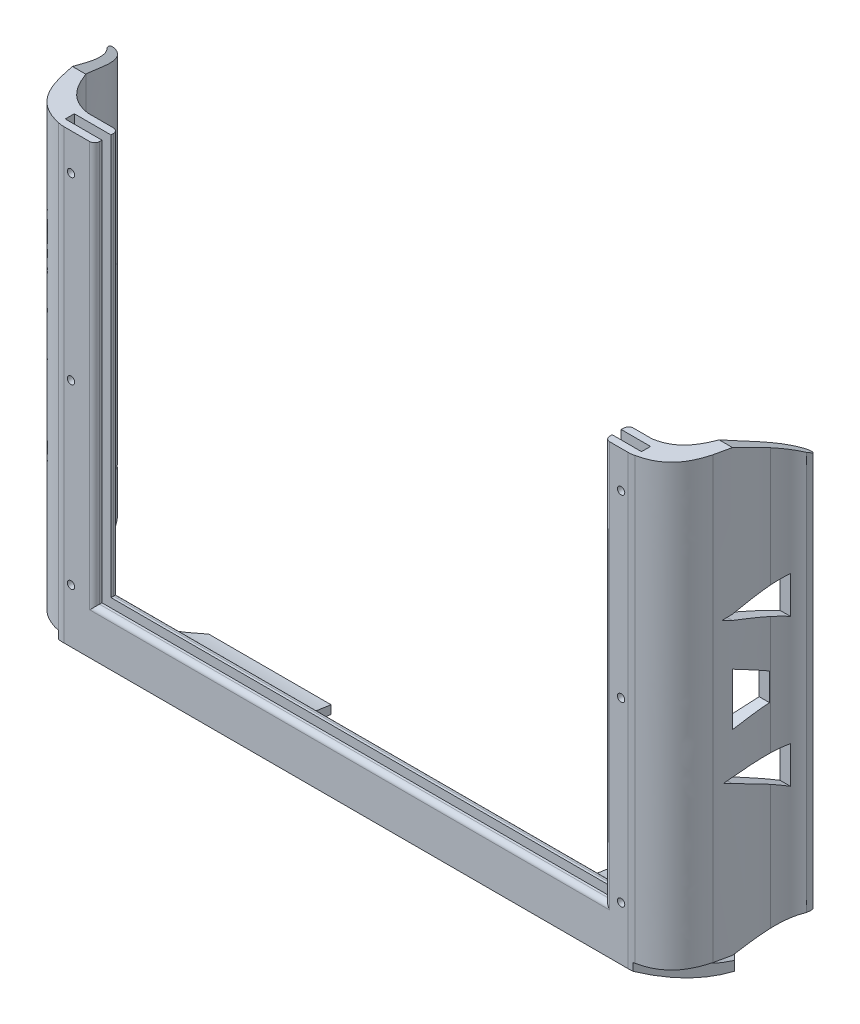
from build123d import *

# Parameters (mm, degrees)
SKETCH_1_W           = 235
SKETCH_1_H           = 175.89
EXTRUDE_1_DEPTH      = 3
SKETCH_2_W           = 235
SKETCH_2_H           = 3
EXTRUDE_2_DEPTH      = 4
SKETCH_3_W           = 235
SKETCH_3_H           = 3
EXTRUDE_3_DEPTH      = 7
SKETCH_5_W           = 235
SKETCH_5_H           = 3
CUT_EXTRUDE_2_DEPTH  = 0.3
EXTRUDE_4_DEPTH      = 0.35
EXTRUDE_5_DEPTH      = 0.35
SKETCH_8_W           = 9.7
SKETCH_8_H           = 179.89
EXTRUDE_6_DEPTH      = 3
SKETCH_9_W           = 9.7
SKETCH_9_H           = 179.89
EXTRUDE_7_DEPTH      = 3
SKETCH_10_W          = 3
SKETCH_10_H          = 176.89
EXTRUDE_8_DEPTH      = 235.7
SKETCH_11_W          = 208.7
SKETCH_11_H          = 163.89
CUT_EXTRUDE_4_DEPTH  = 153.160098334
EXTRUDE_9_DEPTH      = 179.89
FILLET_3_R           = 2
FILLET_4_R           = 2
FILLET_5_R           = 10
SKETCH_13_R          = 1.5
CUT_EXTRUDE_5_DEPTH  = 184.480476092
FILLET_6_R           = 10
FILLET_7_R           = 20
FILLET_8_R           = 0.7
EXTRUDE_10_DEPTH     = 179.89
FILLET_9_R           = 20
EXTRUDE_12_DEPTH     = 235
CUT_EXTRUDE_9_DEPTH  = 235
CUT_EXTRUDE_START    = -235
CUT_EXTRUDE_10_DEPTH = 235
SKETCH_22_W          = 115
SKETCH_22_H          = 25
CUT_EXTRUDE_11_DEPTH = 235
EXTRUDE_13_REACH     = 259.409
CUT_EXTRUDE_12_DEPTH = 235
EXTRUDE_14_REACH     = 259.409
CUT_EXTRUDE_13_DEPTH = 235
CUT_EXTRUDE_14_DEPTH = 235
CUT_EXTRUDE_START_2  = -31.099365542
CUT_EXTRUDE_18_DEPTH = 297.898731085
CUT_EXTRUDE_19_DEPTH = 237.996358915
CHAMFER_1_SIZE       = 10


# Read off the part's stored shape, not the designer's step: 切除-拉伸18
with BuildPart() as part:
    # 草图1 → 凸台-拉伸1 (new body)
    with BuildSketch(Plane.XY):
        Rectangle(SKETCH_1_W, SKETCH_1_H)
    extrude(amount=EXTRUDE_1_DEPTH)

    # 草图2 → 凸台-拉伸2 (add)
    with BuildSketch(Plane.XZ.offset(87.945)):
        with Locations((0, 1.5)):
            Rectangle(SKETCH_2_W, SKETCH_2_H)
    extrude(amount=EXTRUDE_2_DEPTH)

    # 草图3 → 凸台-拉伸3 (add)
    with BuildSketch(Plane.XY.offset(3)):
        with Locations((0, -90.445)):
            Rectangle(SKETCH_3_W, SKETCH_3_H)
    extrude(amount=EXTRUDE_3_DEPTH)

    # 草图5 → 切除-拉伸2 (cut)
    with BuildSketch(Plane.XY.offset(10)):
        with Locations((0, -90.445)):
            Rectangle(SKETCH_5_W, SKETCH_5_H)
    extrude(amount=-CUT_EXTRUDE_2_DEPTH, mode=Mode.SUBTRACT)

    # 草图6 → 凸台-拉伸4 (add)
    with BuildSketch(Plane(origin=(117.5, 0, 0), x_dir=(0, 0, -1), z_dir=(1, 0, 0))):
        Polygon((-9.7, -88.945), (-9.7, -91.945), (0, -91.945), (0, 87.945), (-3, 87.945), (-3, -88.945), align=None)
    extrude(amount=EXTRUDE_4_DEPTH)

    # 草图7 → 凸台-拉伸5 (add)
    with BuildSketch(Plane.ZY.offset(117.5)):
        Polygon((9.7, -91.945), (9.7, -88.945), (3, -88.945), (3, 87.945), (0, 87.945), (0, -91.945), align=None)
    extrude(amount=EXTRUDE_5_DEPTH)

    # 草图8 → 凸台-拉伸6 (add)
    with BuildSketch(Plane.ZY.offset(117.85)):
        with Locations((4.85, -2)):
            Rectangle(SKETCH_8_W, SKETCH_8_H)
    extrude(amount=EXTRUDE_6_DEPTH)

    # 草图9 → 凸台-拉伸7 (add)
    with BuildSketch(Plane(origin=(117.85, 0, 0), x_dir=(0, 0, -1), z_dir=(1, 0, 0))):
        with Locations((-4.85, -2)):
            Rectangle(SKETCH_9_W, SKETCH_9_H)
    extrude(amount=EXTRUDE_7_DEPTH)

    # 草图10 → 凸台-拉伸8 (add)
    with BuildSketch(Plane(origin=(-117.85, 0, 0), x_dir=(0, 0, -1), z_dir=(1, 0, 0))):
        with Locations((-8.2, -0.5)):
            Rectangle(SKETCH_10_W, SKETCH_10_H)
    extrude(amount=EXTRUDE_8_DEPTH)

    # 草图11 → 切除-拉伸4 (cut, through all)
    with BuildSketch(Plane(origin=(0, 0, 0), x_dir=(-1, 0, 0), z_dir=(0, 0, -1))):
        with Locations((-1.5, 6)):
            Rectangle(SKETCH_11_W, SKETCH_11_H)
    extrude(amount=-CUT_EXTRUDE_4_DEPTH, mode=Mode.SUBTRACT)

    # 草图12 → 凸台-拉伸9 (add)
    with BuildSketch(Plane(origin=(0, 87.945, 0), x_dir=(1, 0, 0), z_dir=(0, 1, 0))):
        Polygon((120.85, -9.7), (149.423934101, 34.3), (149.423934101, 44), (120.85, 0), align=None)
        Polygon((-120.85, 0), (-149.423934101, 44), (-149.423934101, 34.3), (-120.85, -9.7), align=None)
    extrude(amount=-EXTRUDE_9_DEPTH)

    # 圆角3
    fillet_3_edges = [part.edges().sort_by_distance(p)[0] for p in [
        (105.85, 6, 0),
        (1.5, -75.945, 0),
        (-102.85, 6, 0),
    ]]
    fillet(fillet_3_edges, radius=FILLET_3_R)

    # 圆角4
    fillet_4_edges = [part.edges().sort_by_distance(p)[0] for p in [
        (105.85, 6, 9.7),
        (-102.85, 6, 9.7),
        (1.5, -75.945, 9.7),
    ]]
    fillet(fillet_4_edges, radius=FILLET_4_R)

    # 圆角5
    fillet_5_edges = [part.edges().sort_by_distance(p)[0] for p in [
        (120.85, -2, 0),
        (-120.85, -2, 0),
    ]]
    fillet(fillet_5_edges, radius=FILLET_5_R)

    # 草图13 → 切除-拉伸5 (cut, through all)
    with BuildSketch(Plane.XY.offset(9.7)):
        with Locations((112.5, -0.445)):
            Circle(SKETCH_13_R)
        with Locations((-112.5, -0.445)):
            Circle(SKETCH_13_R)
        with Locations((112.5, -72.945)):
            Circle(SKETCH_13_R)
        with Locations((-112.5, -72.945)):
            Circle(SKETCH_13_R)
        with Locations((-112.5, 72.945)):
            Circle(SKETCH_13_R)
        with Locations((112.5, 72.945)):
            Circle(SKETCH_13_R)
    extrude(amount=-CUT_EXTRUDE_5_DEPTH, mode=Mode.SUBTRACT)

    # 圆角6
    fillet_6_edges = [part.edges().sort_by_distance(p)[0] for p in [
        (120.85, -2, 9.7),
        (-120.85, -2, 9.7),
    ]]
    fillet(fillet_6_edges, radius=FILLET_6_R)

    # 圆角7
    fillet_7_edges = [part.edges().sort_by_distance(p)[0] for p in [
        (149.423934101, -2, -34.3),
        (-149.423934101, -2, -34.3),
    ]]
    fillet(fillet_7_edges, radius=FILLET_7_R)

    # 圆角8
    fillet_8_edges = [part.edges().sort_by_distance(p)[0] for p in [
        (149.423934101, -2, -44),
        (-149.423934101, -2, -44),
    ]]
    fillet(fillet_8_edges, radius=FILLET_8_R)

    # 草图14 → 凸台-拉伸10 (add)
    with BuildSketch(Plane.XZ.offset(91.945)):
        with BuildLine():
            Line((123.807148683, 5.14639035), (146.19734546, -29.331489199))
            Line((146.19734546, -29.331489199), (126.807148683, 5.14639035))
            Line((126.807148683, 5.14639035), (120.192030606, 8.488171127))
            ThreePointArc((120.192030606, 8.488171127), (122.208450459, 7.043225094), (123.807148683, 5.14639035))
        make_face()
        with BuildLine():
            Line((-146.19734546, -29.331489199), (-123.807148683, 5.14639035))
            ThreePointArc((-123.807148683, 5.14639035), (-122.208450459, 7.043225094), (-120.192030606, 8.488171127))
            Line((-120.192030606, 8.488171127), (-126.807148683, 5.14639035))
            Line((-126.807148683, 5.14639035), (-146.19734546, -29.331489199))
        make_face()
    extrude(amount=-EXTRUDE_10_DEPTH)

    # 圆角9
    fillet_9_edges = [part.edges().sort_by_distance(p)[0] for p in [
        (126.807148683, -2, 5.14639035),
        (-126.807148683, -2, 5.14639035),
    ]]
    fillet(fillet_9_edges, radius=FILLET_9_R)

    # 草图15 → 凸台-拉伸12 (add)
    with BuildSketch(Plane(origin=(-117.85, 0, 0), x_dir=(0, 0, -1), z_dir=(1, 0, 0))):
        with BuildLine():
            Line((-9.7, -88.945), (-3, -88.945))
            add(Edge.make_bspline(
                [(-3, -88.945), (19.526886745, -111.923000939), (42.018086929, -113.900962364)],
                knots=[0, 0, 0, 0.738768562, 0.738768562, 0.738768562], degree=2))
            Line((42.018086929, -113.900962364), (42.018086929, -117.334480304))
            add(Edge.make_bspline(
                [(-9.692894648, -94.945), (20.068714734, -116.023054989), (42.018086929, -117.334480304)],
                knots=[0, 0, 0, 0.732582665, 0.732582665, 0.732582665], degree=2))
            Line((-9.692894648, -94.945), (-9.7, -94.945))
            Line((-9.7, -94.945), (-9.7, -88.945))
        make_face()
    extrude(amount=EXTRUDE_12_DEPTH)

    # 草图20 → 切除-拉伸9 (cut)
    with BuildSketch(Plane(origin=(0, -88.945, 0), x_dir=(1, 0, 0), z_dir=(0, 1, 0))):
        with BuildLine():
            Line((-117.85, -9.400373849), (-117.85, -9.7))
            Line((-117.85, -9.7), (-115.420443004, -9.7))
            ThreePointArc((-115.420443004, -9.7), (-116.644424522, -9.624810791), (-117.85, -9.400373849))
        make_face()
    extrude(amount=-CUT_EXTRUDE_9_DEPTH, mode=Mode.SUBTRACT)

    # 草图21 → 切除-拉伸10 (cut)
    with BuildSketch(Plane(origin=(0, -88.945, 0), x_dir=(1, 0, 0), z_dir=(0, 1, 0)).offset(CUT_EXTRUDE_START)):
        with BuildLine():
            Line((115.420443004, -9.7), (117.15, -9.7))
            Line((117.15, -9.7), (117.15, -9.549296046))
            ThreePointArc((117.15, -9.549296046), (116.28849817, -9.662252769), (115.420443004, -9.7))
        make_face()
    extrude(amount=CUT_EXTRUDE_10_DEPTH, mode=Mode.SUBTRACT)

    # 草图22 → 切除-拉伸11 (cut)
    with BuildSketch(Plane(origin=(0, -88.945, 0), x_dir=(1, 0, 0), z_dir=(0, 1, 0))):
        with Locations((-0.35, 29.518086929)):
            Rectangle(SKETCH_22_W, SKETCH_22_H)
    extrude(amount=-CUT_EXTRUDE_11_DEPTH, mode=Mode.SUBTRACT)

    # 凸台-拉伸13: up to this face of the body (flat: up to its plane)
    extrude_13_end = Plane(part.part.faces().sort_by_distance((132.918851184, -91.945, -13.258300004))[0])
    # 草图23 → 凸台-拉伸13 (add, up to the picked face)
    with BuildSketch(Plane(origin=(0, 87.945, 0), x_dir=(1, 0, 0), z_dir=(0, 1, 0)), mode=Mode.PRIVATE) as extrude_13_sk1:
        with BuildLine():
            Line((115.420443004, 0), (121.40521795, -1.091050521))
            Line((121.40521795, -1.091050521), (121.40521795, -5.560156289))
            Line((121.40521795, -5.560156289), (117.881975934, -9.392309097))
            add(Edge.make_bspline(
                [(117.881975934, -9.392309097), (143.309445023, -3.921155734), (127.878538817, 30.199204345), (148.949365443, 39.75614089)],
                knots=[0, 0, 0, 0, 1, 1, 1, 1], degree=3))
            add(Edge.make_bspline(
                [(115.420443004, 0), (137.483275863, 3.455963103), (126.195298106, 39.01849051), (148.949365443, 39.75614089)],
                knots=[0, 0, 0, 0, 1, 1, 1, 1], degree=3))
        make_face()
    extrude_13_tool1 = split(extrude(extrude_13_sk1.sketch, amount=-EXTRUDE_13_REACH, mode=Mode.PRIVATE), bisect_by=extrude_13_end, keep=Keep.BOTH, mode=Mode.PRIVATE)
    add(extrude_13_tool1.solids().sort_by(Axis((130.954103, 87.945, -12.051978), (0, -1, 0)))[0])

    # 草图24 → 切除-拉伸12 (cut)
    with BuildSketch(Plane(origin=(0, 87.945, 0), x_dir=(1, 0, 0), z_dir=(0, 1, 0)).offset(CUT_EXTRUDE_START)):
        with BuildLine():
            add(Edge.make_bspline(
                [(146.519921764, 39.528213148), (147.283857688, 39.651194333), (148.092472485, 39.728361795), (148.949365442, 39.756140891)],
                knots=[0.962341108, 0.962341108, 0.962341108, 0.962341108, 1, 1, 1, 1], degree=3))
            add(Edge.make_bspline(
                [(145.248730504, 37.570750264), (146.339481633, 38.395087447), (147.565724965, 39.128573473), (148.949365442, 39.756140891)],
                knots=[0.93433383, 0.93433383, 0.93433383, 0.93433383, 1, 1, 1, 1], degree=3))
            Line((145.248730504, 37.570750264), (137.794188972, 26.091762938))
            add(Edge.make_bspline(
                [(133.560005412, 6.860923634), (135.235681248, 13.035951619), (135.853715624, 19.991949083), (137.794188972, 26.091762938)],
                knots=[0.388915738, 0.388915738, 0.388915738, 0.388915738, 0.702262243, 0.702262243, 0.702262243, 0.702262243], degree=3))
            Line((133.560005412, 6.860923634), (146.19734546, 29.331489199))
            ThreePointArc((146.19734546, 29.331489199), (148.600328798, 34.543963005), (149.423934101, 40.224269899))
            Line((149.423934101, 40.224269899), (149.423934101, 41.636839604))
            ThreePointArc((149.423934101, 41.636839604), (148.922744842, 42.308013419), (148.136864703, 42.018086929))
            Line((148.136864703, 42.018086929), (146.519921764, 39.528213148))
        make_face()
        with BuildLine():
            add(Edge.make_bspline(
                [(122.096609477, 2.55494787), (125.743241606, 5.055088949), (127.894744192, 8.979793722), (129.526389128, 13.36046763)],
                knots=[0.121285772, 0.121285772, 0.121285772, 0.121285772, 0.364975533, 0.364975533, 0.364975533, 0.364975533], degree=3))
            Line((129.526389128, 13.36046763), (123.807148683, 4.55360965))
            ThreePointArc((123.807148683, 4.55360965), (123.01788939, 3.497784347), (122.096609477, 2.55494787))
        make_face()
    extrude(amount=CUT_EXTRUDE_12_DEPTH, mode=Mode.SUBTRACT)

    # 凸台-拉伸14: up to this face of the body (flat: up to its plane)
    extrude_14_end = Plane(part.part.faces().sort_by_distance((-133.208698485, -91.945, -13.596287992))[0])
    # 草图26 → 凸台-拉伸14 (add, up to the picked face)
    with BuildSketch(Plane(origin=(0, 87.945, 0), x_dir=(1, 0, 0), z_dir=(0, 1, 0)), mode=Mode.PRIVATE) as extrude_14_sk1:
        with BuildLine():
            Line((121.40521795, -5.560156289), (117.881975934, -9.392309097))
            add(Edge.make_bspline(
                [(117.881975934, -9.392309097), (143.309445023, -3.921155734), (127.878538817, 30.199204345), (148.949365443, 39.75614089)],
                knots=[0, 0, 0, 0, 1, 1, 1, 1], degree=3))
            add(Edge.make_bspline(
                [(148.949365443, 39.75614089), (126.195298106, 39.01849051), (137.483275863, 3.455963103), (115.420443004, 0)],
                knots=[0, 0, 0, 0, 1, 1, 1, 1], degree=3))
            Line((115.420443004, 0), (121.40521795, -1.091050521))
            Line((121.40521795, -1.091050521), (121.40521795, -5.560156289))
        make_face()
    extrude_14_tool1 = split(extrude(extrude_14_sk1.sketch, amount=-EXTRUDE_14_REACH, mode=Mode.PRIVATE), bisect_by=extrude_14_end, keep=Keep.BOTH, mode=Mode.PRIVATE)
    # 草图26 → 凸台-拉伸14 (add, up to the picked face)
    with BuildSketch(Plane(origin=(0, 87.945, 0), x_dir=(1, 0, 0), z_dir=(0, 1, 0)), mode=Mode.PRIVATE) as extrude_14_sk2:
        with BuildLine():
            Line((-115.420443004, 0), (-121.40521795, -1.091050521))
            Line((-121.40521795, -1.091050521), (-121.40521795, -5.560156289))
            Line((-121.40521795, -5.560156289), (-117.881975934, -9.392309097))
            add(Edge.make_bspline(
                [(-117.881975934, -9.392309097), (-143.309445023, -3.921155734), (-127.878538817, 30.199204345), (-148.949365443, 39.75614089)],
                knots=[0, 0, 0, 0, 1, 1, 1, 1], degree=3))
            add(Edge.make_bspline(
                [(-148.949365443, 39.75614089), (-126.195298106, 39.01849051), (-137.483275863, 3.455963103), (-115.420443004, 0)],
                knots=[0, 0, 0, 0, 1, 1, 1, 1], degree=3))
        make_face()
    extrude_14_tool2 = split(extrude(extrude_14_sk2.sketch, amount=-EXTRUDE_14_REACH, mode=Mode.PRIVATE), bisect_by=extrude_14_end, keep=Keep.BOTH, mode=Mode.PRIVATE)
    add(extrude_14_tool1.solids().sort_by(Axis((130.954103, 87.945, -12.051978), (0, -1, 0)))[0])
    add(extrude_14_tool2.solids().sort_by(Axis((-130.954103, 87.945, -12.051978), (0, -1, 0)))[0])

    # 草图27 → 切除-拉伸13 (cut)
    with BuildSketch(Plane(origin=(0, 87.945, 0), x_dir=(1, 0, 0), z_dir=(0, 1, 0)).offset(CUT_EXTRUDE_START)):
        with BuildLine():
            Line((-137.794188972, 26.091762938), (-145.248730504, 37.570750264))
            add(Edge.make_bspline(
                [(-145.248730504, 37.570750264), (-146.339481633, 38.395087447), (-147.565724965, 39.128573473), (-148.949365443, 39.75614089)],
                knots=[0.93433383, 0.93433383, 0.93433383, 0.93433383, 1, 1, 1, 1], degree=3))
            add(Edge.make_bspline(
                [(-148.949365443, 39.75614089), (-148.092472485, 39.728361795), (-147.283857688, 39.651194332), (-146.519921764, 39.528213148)],
                knots=[0, 0, 0, 0, 0.037658892, 0.037658892, 0.037658892, 0.037658892], degree=3))
            Line((-146.519921764, 39.528213148), (-148.136864703, 42.018086929))
            ThreePointArc((-148.136864703, 42.018086929), (-148.922744842, 42.308013419), (-149.423934101, 41.636839604))
            Line((-149.423934101, 41.636839604), (-149.423934101, 40.224269899))
            ThreePointArc((-149.423934101, 40.224269899), (-148.600328798, 34.543963005), (-146.19734546, 29.331489199))
            Line((-146.19734546, 29.331489199), (-133.560005412, 6.860923634))
            add(Edge.make_bspline(
                [(-133.560005412, 6.860923634), (-135.235681248, 13.035951619), (-135.853715624, 19.991949083), (-137.794188972, 26.091762938)],
                knots=[0.388915738, 0.388915738, 0.388915738, 0.388915738, 0.702262243, 0.702262243, 0.702262243, 0.702262243], degree=3))
        make_face()
        with BuildLine():
            Line((-123.807148683, 4.55360965), (-129.526389128, 13.36046763))
            add(Edge.make_bspline(
                [(-129.526389128, 13.36046763), (-127.894744192, 8.979793722), (-125.743241606, 5.055088949), (-122.096609477, 2.55494787)],
                knots=[0.635024467, 0.635024467, 0.635024467, 0.635024467, 0.878714228, 0.878714228, 0.878714228, 0.878714228], degree=3))
            ThreePointArc((-122.096609477, 2.55494787), (-123.01788939, 3.497784347), (-123.807148683, 4.55360965))
        make_face()
    extrude(amount=CUT_EXTRUDE_13_DEPTH, mode=Mode.SUBTRACT)

    # 草图28 → 切除-拉伸14 (cut)
    with BuildSketch(Plane(origin=(0, -88.945, 0), x_dir=(1, 0, 0), z_dir=(0, 1, 0))):
        Polygon((-46.533330053, 8.2738522), (-43.283330053, 17.018086929), (-49.783330053, 17.018086929), align=None)
        Polygon((-36.033330053, 8.2738522), (-32.783330053, 17.018086929), (-39.283330053, 17.018086929), align=None)
        Polygon((-25.533330053, 8.2738522), (-22.283330053, 17.018086929), (-28.783330053, 17.018086929), align=None)
        Polygon((-15.033330053, 8.2738522), (-11.783330053, 17.018086929), (-18.283330053, 17.018086929), align=None)
        Polygon((-4.533330053, 8.2738522), (-1.283330053, 17.018086929), (-7.783330053, 17.018086929), align=None)
        Polygon((5.966669947, 8.2738522), (9.216669947, 17.018086929), (2.716669947, 17.018086929), align=None)
        Polygon((16.466669947, 8.2738522), (19.716669947, 17.018086929), (13.216669947, 17.018086929), align=None)
        Polygon((26.966669947, 8.2738522), (30.216669947, 17.018086929), (23.716669947, 17.018086929), align=None)
        Polygon((47.966669947, 8.2738522), (51.216669947, 17.018086929), (44.716669947, 17.018086929), align=None)
        Polygon((-84.767070312, 17.018086929), (-77.011440675, 32.2820979), (-99.611798313, 32.2820979), (-90.932929688, 17.018086929), align=None)
        Polygon((-87.676810601, 11.291368433), (-84.767070312, 17.018086929), (-90.932929688, 17.018086929), align=None)
        Polygon((99.611798313, 32.2820979), (77.011440675, 32.2820979), (84.767070312, 17.018086929), (90.932929688, 17.018086929), align=None)
        Polygon((90.932929688, 17.018086929), (84.767070312, 17.018086929), (87.676810601, 11.291368433), align=None)
        Polygon((37.466669947, 8.2738522), (40.716669947, 17.018086929), (34.216669947, 17.018086929), align=None)
    extrude(amount=-CUT_EXTRUDE_14_DEPTH, mode=Mode.SUBTRACT)

    # 切除-拉伸18 outline → 切除-拉伸18 (cut)
    with BuildSketch(Plane.ZY.offset(-117.85).offset(CUT_EXTRUDE_START_2)):
        Polygon((-57.885543859, -105.60694114), (-13.36046763, -91.945), (-39.528213148, -82.431801128), (-39.528213148, 77.607543025), (-13.36046763, 87.945), (-13.36046763, 107.482295686), (-57.885543859, 136.889010788), (-67.268329543, 29.572987265), align=None)
        Polygon((-31.831256601, -23.53362652), (-31.831256601, -38.660230374), (-13.36046763, -31.145984748), (-10.248107799, -29.836755538), (-13.36046763, -28.825018873), align=None)
        Polygon((-31.831256601, 36.68592538), (-31.831256601, 21.526552369), (-13.36046763, 26.707273922), (-9.691882515, 28.103073011), (-13.36046763, 28.918281404), align=None)
        Polygon((-25.814055352, 3.929101955), (-25.814055352, -7.304779227), (-13.36046763, -12.003343681), (-13.36046763, 9.431829249), align=None)
    extrude(amount=CUT_EXTRUDE_18_DEPTH, mode=Mode.SUBTRACT)

    # 草图31 → 切除-拉伸19 (cut, through all)
    with BuildSketch(Plane.XZ.offset(91.945)):
        with BuildLine():
            Line((137.723620817, -41.230855029), (145.187307416, -42.670603002))
            Line((145.187307416, -42.670603002), (143.453337962, -35.184175784))
            Line((143.453337962, -35.184175784), (143.051302811, -35.60845111))
            add(Edge.make_bspline(
                [(143.051302811, -35.60845111), (145.024763967, -38.956446124), (141.191600235, -37.571030532)],
                knots=[0, 0, 0, 1, 1, 1], degree=2))
            Line((141.191600235, -37.571030532), (137.723620817, -41.230855029))
        make_face()
        with BuildLine():
            Line((-144.035610852, -35.759543729), (-145.539862047, -42.152446697))
            Line((-145.539862047, -42.152446697), (-139.676612015, -40.427877279))
            Line((-139.676612015, -40.427877279), (-141.936079482, -38.008067554))
            add(Edge.make_bspline(
                [(-141.936079482, -38.008067554), (-145.59372144, -39.370509128), (-143.631839656, -36.191968396)],
                knots=[0, 0, 0, 1, 1, 1], degree=2))
            Line((-143.631839656, -36.191968396), (-144.035610852, -35.759543729))
        make_face()
    extrude(amount=-CUT_EXTRUDE_19_DEPTH, mode=Mode.SUBTRACT)


with BuildPart() as cut_extrude_19_kept_piece:
    # of the separate pieces the step leaves, the one the design keeps (cut_extrude_19_pieces_kept)
    add(part.part.solids().sort_by_distance((133.560005412, 87.945, -6.860923634))[0])

    # 倒角1
    chamfer_1_edges = [cut_extrude_19_kept_piece.edges().sort_by_distance(p)[0] for p in [
        (-117.85, -115.617721334, -42.018086929),
        (117.15, -115.617721334, -42.018086929),
    ]]
    chamfer(chamfer_1_edges, length=CHAMFER_1_SIZE)


solid = cut_extrude_19_kept_piece.part
